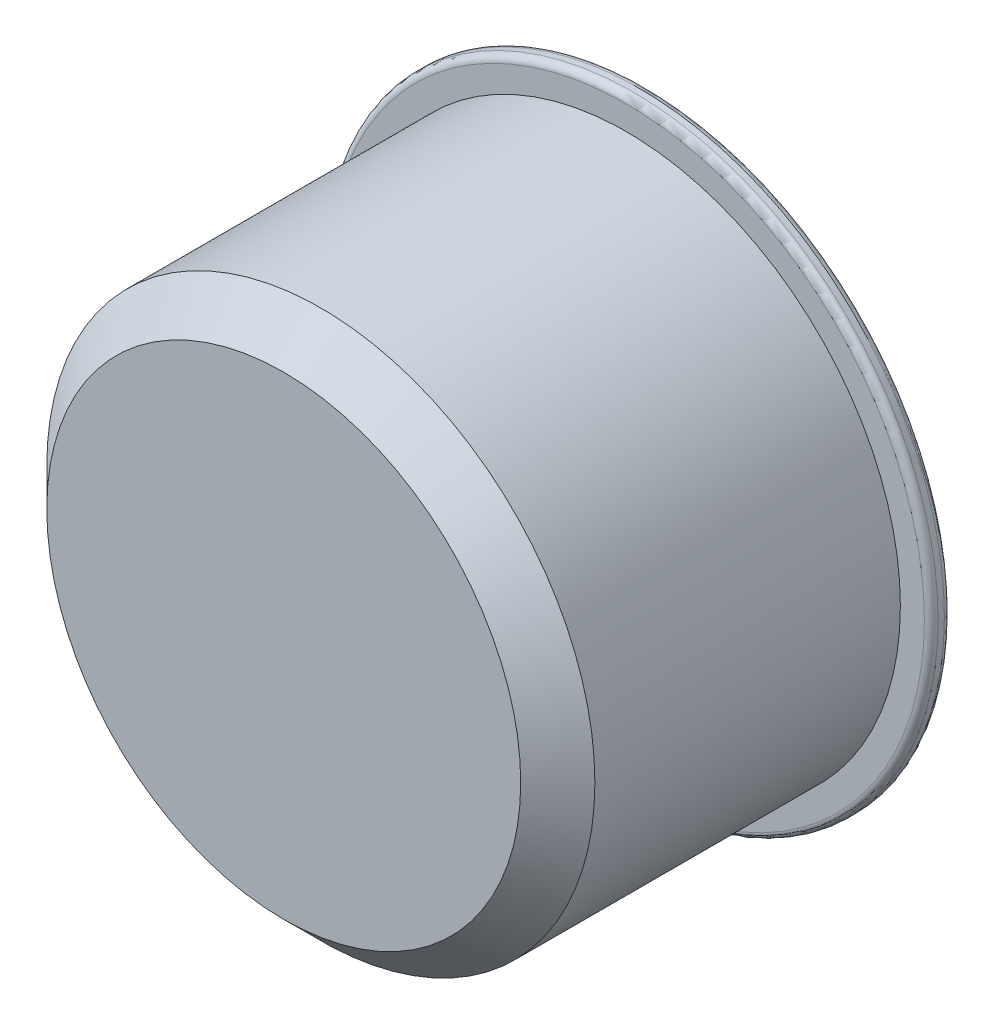
from build123d import *

# Parameters (mm, degrees)
SKETCH_2_R          = 8.9
EXTRUDE_1_DEPTH     = 1.6
SKETCH_4_R          = 8
EXTRUDE_2_DEPTH     = 10
SKETCH_7_R          = 6.5
SKETCH_7_R_2        = 4.5
CUT_EXTRUDE_1_DEPTH = 0.5
CUT_EXTRUDE_2_DEPTH = 0.2
CHAMFER_1_SIZE      = 0.1
FILLET_1_R          = 0.2


# Read off the part's stored shape, not the designer's step: M16 机械螺纹 螺柱1
with BuildPart() as part:
    # 草图2 → 凸台-拉伸1 (new body)
    with BuildSketch(Plane.XY):
        Circle(SKETCH_2_R)
    extrude(amount=EXTRUDE_1_DEPTH)

    # 草图3 → 切除-旋转1 (revolve, cut)
    with BuildSketch(Plane(origin=(0, 0, 0), x_dir=(1, 0, 0), z_dir=(0, 1, 0))):
        Polygon((-8.9, -1.1), (-7, 0), (-8.9, 0), align=None)
    revolve(axis=Axis((0, 0, -2.565533084), (0, 0, 1)), mode=Mode.SUBTRACT)

    # 草图4 → 凸台-拉伸2 (add)
    with BuildSketch(Plane.XY.offset(1.6)):
        Circle(SKETCH_4_R)
    extrude(amount=EXTRUDE_2_DEPTH)

    # M16 机械螺纹 螺柱1 outline → M16 机械螺纹 螺柱1 (revolve, cut)
    with BuildSketch(Plane.XZ):
        Polygon((8, 11.6), (6.9175, 11.6), (8, 10.5175), align=None)
    revolve(axis=Axis((0, 0, 0), (0, 0, 1)), mode=Mode.SUBTRACT)

    # 草图7 → 切除-拉伸1 (cut)
    with BuildSketch(Plane(origin=(0, 0, 0), x_dir=(-1, 0, 0), z_dir=(0, 0, -1))):
        Circle(SKETCH_7_R)
        Circle(SKETCH_7_R_2, mode=Mode.SUBTRACT)
    extrude(amount=-CUT_EXTRUDE_1_DEPTH, mode=Mode.SUBTRACT)

    # 草图8 → 切除-拉伸2 (cut)
    with BuildSketch(Plane(origin=(0, 0, 0), x_dir=(-1, 0, 0), z_dir=(0, 0, -1))):
        with BuildLine():
            Line((1.643434087, 2.281182047), (1.702030214, 2.362516878))
            ThreePointArc((1.702030214, 2.362516878), (1.839011457, 2.444004167), (1.992055967, 2.399491052))
            ThreePointArc((1.992055967, 2.399491052), (0, -3.11862859), (-1.992055967, 2.399491052))
            ThreePointArc((-1.992055967, 2.399491052), (-1.839011457, 2.444004167), (-1.702030214, 2.362516878))
            Line((-1.702030214, 2.362516878), (-1.643434087, 2.281182047))
            ThreePointArc((-1.643434087, 2.281182047), (-1.607282835, 2.139224365), (-1.677581098, 2.010705686))
            ThreePointArc((-1.677581098, 2.010705686), (0, -2.61862859), (1.677581098, 2.010705686))
            ThreePointArc((1.677581098, 2.010705686), (1.607282835, 2.139224365), (1.643434087, 2.281182047))
        make_face()
        with BuildLine():
            Line((-0.050122003, 1.280793561), (0.050122003, 1.280793561))
            ThreePointArc((0.050122003, 1.280793561), (0.191543359, 1.339372204), (0.250122003, 1.480793561))
            Line((0.250122003, 1.480793561), (0.250122003, 3.214947097))
            ThreePointArc((0.250122003, 3.214947097), (0.191543359, 3.356368453), (0.050122003, 3.414947097))
            Line((0.050122003, 3.414947097), (-0.050122003, 3.414947097))
            ThreePointArc((-0.050122003, 3.414947097), (-0.191543359, 3.356368453), (-0.250122003, 3.214947097))
            Line((-0.250122003, 3.214947097), (-0.250122003, 1.480793561))
            ThreePointArc((-0.250122003, 1.480793561), (-0.191543359, 1.339372204), (-0.050122003, 1.280793561))
        make_face()
    extrude(amount=-CUT_EXTRUDE_2_DEPTH, mode=Mode.SUBTRACT)

    # 倒角1
    chamfer_1_edges = [part.edges().sort_by_distance(p)[0] for p in [
        (6.5, 0, 0),
        (4.5, 0, 0),
    ]]
    chamfer(chamfer_1_edges, length=CHAMFER_1_SIZE)

    # 圆角1
    fillet_1_edges = [part.edges().sort_by_distance(p)[0] for p in [
        (-8.9, 0, 1.6),
        (0, 8.9, 1.1),
    ]]
    fillet(fillet_1_edges, radius=FILLET_1_R)


solid = part.part
